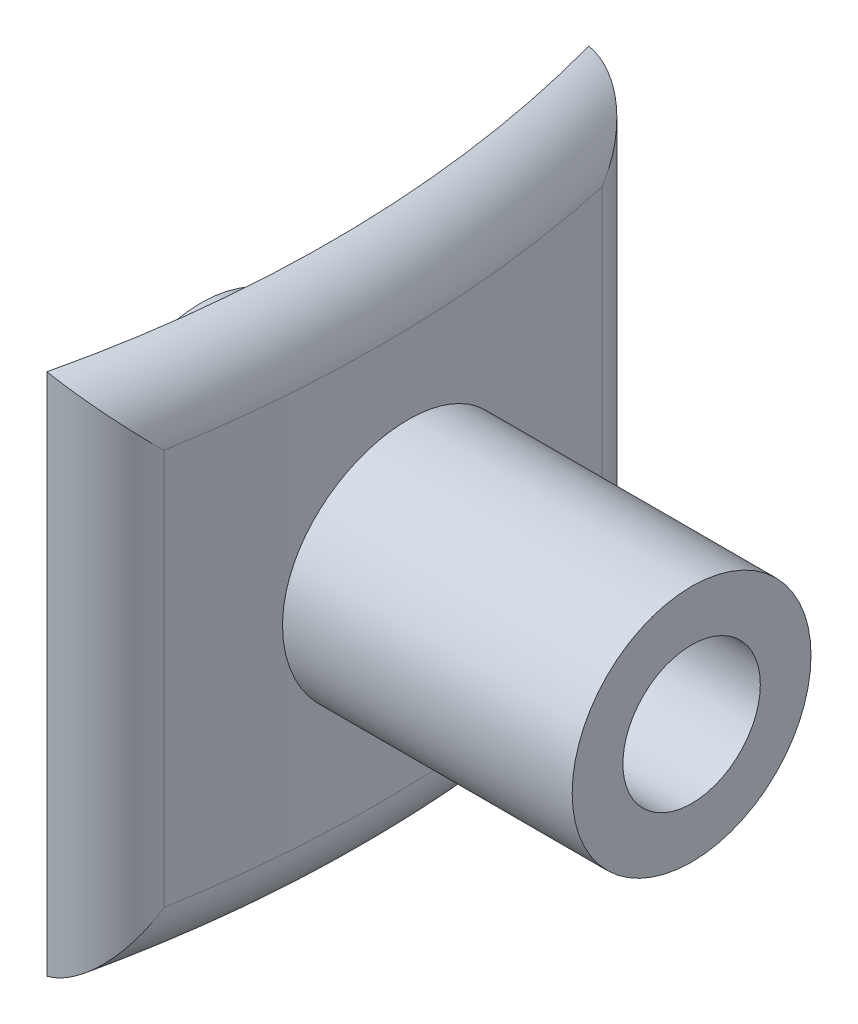
from build123d import *
from OCP.BRepAlgoAPI import BRepAlgoAPI_Cut
from OCP.TopTools import TopTools_ListOfShape

# Parameters (mm, degrees)
SKETCH3_R                = 3.65
SKETCH3_R_2              = 2.1
BOSS_EXTRUDE3_DEPTH      = 15
BOSS_EXTRUDE4_DEPTH      = 8
BOSS_EXTRUDE4_DEPTH_BACK = 8
SKETCH7_R                = 2.1
CUT_EXTRUDE1_DEPTH       = 18
FILLET2_START            = -8
FILLET2_DEPTH            = 16
FILLET2_2_ANGLE          = 28.578113
FILLET2_3_ANGLE          = 28.578113


with BuildPart() as part:
    # Sketch3 → Boss-Extrude3 (new body)
    with BuildSketch(Plane(origin=(0, 0, 0), x_dir=(0, 0, -1), z_dir=(1, 0, 0))):
        Circle(SKETCH3_R)
        Circle(SKETCH3_R_2, mode=Mode.SUBTRACT)
    extrude(amount=BOSS_EXTRUDE3_DEPTH)

    # Sketch6 → Boss-Extrude4 (add, two sides: drawn at the far end of the back side and taken through both)
    with BuildSketch(Plane(origin=(0, 0, 0), x_dir=(1, 0, 0), z_dir=(0, 1, 0)).offset(-BOSS_EXTRUDE4_DEPTH_BACK)):
        with BuildLine():
            Line((3.477507, 8.380826), (4.919958, 8.978308))
            ThreePointArc((4.919958, 8.978308), (6.258182, -0.050001), (5.26999, -9.123296))
            Line((5.26999, -9.123296), (3.819467, -8.52247))
            ThreePointArc((3.819467, -8.52247), (4.707866, -0.049391), (3.477507, 8.380826))
        make_face()
    extrude(amount=BOSS_EXTRUDE4_DEPTH + BOSS_EXTRUDE4_DEPTH_BACK)

    # Sketch7 → Cut-Extrude1 (cut)
    with BuildSketch(Plane.ZY):
        with Locations(Location((0, 0, 0), (0, 0, 180))):
            Circle(SKETCH7_R)
    extrude(amount=-CUT_EXTRUDE1_DEPTH, mode=Mode.SUBTRACT)


with BuildPart() as fillet2_tool:
    # Fillet2: read off the stored shape, not the designer's step
    # Fillet2 outline → Fillet2 (new body)
    with BuildSketch(Plane(origin=(0, 0, 0), x_dir=(1, 0, 0), z_dir=(0, 1, 0)).offset(FILLET2_START)):
        with BuildLine():
            ThreePointArc((5.26999, -9.123296), (5.521856, -7.99803), (5.737351, -6.865235))
            ThreePointArc((5.737351, -6.865235), (5.074459, -8.036465), (3.819467, -8.52247))
            Line((3.819467, -8.52247), (5.26999, -9.123296))
        make_face()
        with BuildLine():
            ThreePointArc((3.477507, 8.380826), (4.751128, 7.945976), (5.460847, 6.802514))
            ThreePointArc((5.460847, 6.802514), (5.20744, 7.894646), (4.919958, 8.978308))
            Line((4.919958, 8.978308), (3.477507, 8.380826))
        make_face()
    extrude(amount=FILLET2_DEPTH)


with BuildPart() as part_1:
    add(part.part)

    # Fillet2: cut by fillet2_tool, with a tolerance
    fillet2_stock = TopTools_ListOfShape()
    fillet2_stock.Append(part_1.part.wrapped)
    fillet2_tools = TopTools_ListOfShape()
    fillet2_tools.Append(fillet2_tool.part.wrapped)
    fillet2_cut = BRepAlgoAPI_Cut()
    fillet2_cut.SetArguments(fillet2_stock)
    fillet2_cut.SetTools(fillet2_tools)
    fillet2_cut.SetFuzzyValue(0.00001)
    fillet2_cut.Build()
    add(Compound.cast(fillet2_cut.Shape()).solids(), mode=Mode.REPLACE)


with BuildPart() as fillet2_2_tool:
    # Fillet2 2 outline → Fillet2 2 (revolve)
    with BuildSketch(Plane(origin=(-29.535127, 0, 0.742139), x_dir=(0.9738567621765157, 0, 0.22716295200378364), z_dir=(-0.22716295200378364, 0, 0.9738567621765157))):
        with BuildLine():
            Line((35.8, -8), (35.8, -6.051282))
            ThreePointArc((35.8, -6.051282), (35.365248, -7.296272), (34.25, -8))
            Line((34.25, -8), (35.8, -8))
        make_face()
    revolve(axis=Axis((-29.535127, 0, 0.742139), (0, 1, 0)), revolution_arc=FILLET2_2_ANGLE)


with BuildPart() as part_2:
    add(part_1.part)

    # Fillet2 2: cut by fillet2_2_tool, with a tolerance
    fillet2_2_stock = TopTools_ListOfShape()
    fillet2_2_stock.Append(part_2.part.wrapped)
    fillet2_2_tools = TopTools_ListOfShape()
    fillet2_2_tools.Append(fillet2_2_tool.part.wrapped)
    fillet2_2_cut = BRepAlgoAPI_Cut()
    fillet2_2_cut.SetArguments(fillet2_2_stock)
    fillet2_2_cut.SetTools(fillet2_2_tools)
    fillet2_2_cut.SetFuzzyValue(0.00001)
    fillet2_2_cut.Build()
    add(Compound.cast(fillet2_2_cut.Shape()).solids(), mode=Mode.REPLACE)


with BuildPart() as fillet2_3_tool:
    # Fillet2 3 outline → Fillet2 3 (revolve)
    with BuildSketch(Plane(origin=(-29.535127, 0, 0.742139), x_dir=(0.9738567621765157, 0, 0.22716295200378342), z_dir=(-0.22716295200378342, 0, 0.9738567621765157))):
        with BuildLine():
            ThreePointArc((34.25, 8), (35.365248, 7.296272), (35.8, 6.051282))
            Line((35.8, 6.051282), (35.8, 8))
            Line((35.8, 8), (34.25, 8))
        make_face()
    revolve(axis=Axis((-29.535127, 0, 0.742139), (0, 1, 0)), revolution_arc=FILLET2_3_ANGLE)


with BuildPart() as part_3:
    add(part_2.part)

    # Fillet2 3: cut by fillet2_3_tool, with a tolerance
    fillet2_3_stock = TopTools_ListOfShape()
    fillet2_3_stock.Append(part_3.part.wrapped)
    fillet2_3_tools = TopTools_ListOfShape()
    fillet2_3_tools.Append(fillet2_3_tool.part.wrapped)
    fillet2_3_cut = BRepAlgoAPI_Cut()
    fillet2_3_cut.SetArguments(fillet2_3_stock)
    fillet2_3_cut.SetTools(fillet2_3_tools)
    fillet2_3_cut.SetFuzzyValue(0.00001)
    fillet2_3_cut.Build()
    add(Compound.cast(fillet2_3_cut.Shape()).solids(), mode=Mode.REPLACE)


solid = part_3.part
